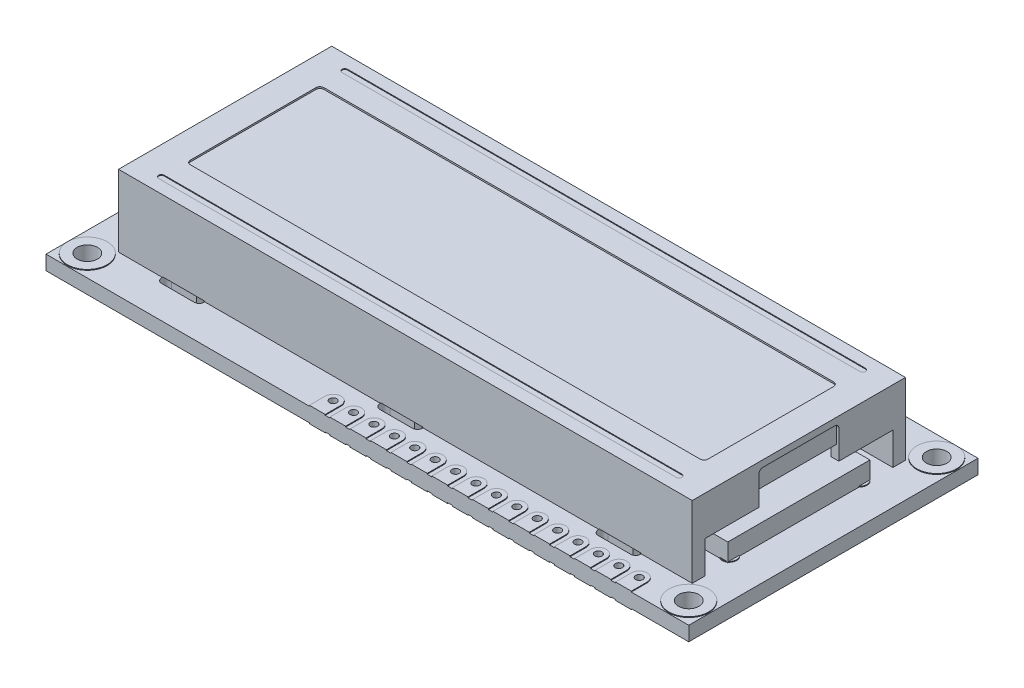
from build123d import *

# Parameters (mm, degrees)
BOSS_EXTRUDE2_START      = 1.79
SKETCH1_W                = 71.407025944
SKETCH1_H                = 26.53942813
BOSS_EXTRUDE2_DEPTH      = 8.93
BOSS_EXTRUDE3_DEPTH      = 1.79
CUT_EXTRUDE1_START       = 10.72
SKETCH4_W                = 64.44
SKETCH4_H                = 16.63
CUT_EXTRUDE1_DEPTH       = 0.2
SKETCH6_R                = 0.352432543
CUT_EXTRUDE4_DEPTH       = 0.1
FILLET1_R                = 0.5
SKETCH7_W                = 23.4
SKETCH7_H                = 4.04
CUT_EXTRUDE5_DEPTH       = 89.379400315
BOSS_EXTRUDE5_START      = -2
SKETCH8_W                = 17.685
SKETCH8_H                = 2.25
BOSS_EXTRUDE5_DEPTH      = 69.41
BOSS_EXTRUDE6_REACH      = 89.981
CUT_EXTRUDE6_DEPTH       = 0.3
FILLET2_R                = 0.5
SKETCH15_W               = 9.96
SKETCH15_H               = 1.67
CUT_EXTRUDE7_DEPTH       = 70.4
CUT_EXTRUDE8_START       = -1
SKETCH18_W               = 6.72
SKETCH18_H               = 1.67
CUT_EXTRUDE8_DEPTH       = 68.4
BOSS_EXTRUDE7_START      = -0.1
SKETCH20_R               = 2.475
BOSS_EXTRUDE7_DEPTH      = 1.99
CUT_EXTRUDE10_DEPTH      = 89.379400315
CUT_EXTRUDE10_DEPTH_BACK = 89.379400315
SKETCH23_R               = 1.27
BOSS_EXTRUDE16_START     = -0.1
SKETCH24_R               = 0.9
BOSS_EXTRUDE16_DEPTH     = 1.99
SKETCH24_R_2             = 0.6
BOSS_EXTRUDE16_2_DEPTH   = 1.99
SKETCH24_W               = 1.2
SKETCH24_H               = 1.204526413
BOSS_EXTRUDE16_3_DEPTH   = 1.99
BOSS_EXTRUDE16_4_DEPTH   = 1.99
BOSS_EXTRUDE16_5_DEPTH   = 1.99
BOSS_EXTRUDE16_6_DEPTH   = 1.99
BOSS_EXTRUDE16_7_DEPTH   = 1.99
BOSS_EXTRUDE16_8_DEPTH   = 1.99
BOSS_EXTRUDE16_9_DEPTH   = 1.99
BOSS_EXTRUDE16_10_DEPTH  = 1.99
CUT_EXTRUDE11_START      = -0.1
SKETCH26_R               = 0.54
SKETCH26_R_2             = 0.45
CUT_EXTRUDE11_DEPTH      = 1.99
BOSS_EXTRUDE17_START     = -0.1
BOSS_EXTRUDE17_DEPTH     = 1.99
CUT_EXTRUDE12_DEPTH      = 89.379400315
CUT_EXTRUDE12_DEPTH_BACK = 89.379400315
SKETCH28_R               = 0.45
SKETCH29_R               = 0.99
SKETCH29_W               = 2
SKETCH29_H               = 1.7
SKETCH29_W_2             = 5.294286071
SKETCH29_H_2             = 1.365740389
SKETCH29_W_3             = 1.6
SKETCH29_H_3             = 1.15
SKETCH29_W_4             = 1.15
SKETCH29_H_4             = 1.6
SKETCH29_W_5             = 1.46
SKETCH29_H_5             = 1.21
SKETCH29_W_6             = 5.294286072
BOSS_EXTRUDE18_DEPTH     = 0.1
CUT_EXTRUDE13_START      = 0.1
SKETCH30_R               = 0.375
CUT_EXTRUDE13_DEPTH      = 1.97
SKETCH31_R               = 0.625142546
CUT_EXTRUDE14_DEPTH      = 1.97
EXTRUDE_THIN1_START      = 1.29
EXTRUDE_THIN1_DEPTH      = 0.375
FILLET3_R                = 0.2
LPATTERN1_COUNT          = 2
LPATTERN1_PITCH          = 2.58
FILLET3_OF_LPATTERN1_R   = 0.2
BOSS_EXTRUDE19_START     = 0.1
BOSS_EXTRUDE19_DEPTH     = 1.89
BOSS_EXTRUDE19_2_DEPTH   = 1.89
BOSS_EXTRUDE19_3_DEPTH   = 1.89
BOSS_EXTRUDE19_4_DEPTH   = 1.89
BOSS_EXTRUDE19_5_DEPTH   = 1.89
BOSS_EXTRUDE19_6_DEPTH   = 1.89
BOSS_EXTRUDE20_START     = 0.1
BOSS_EXTRUDE20_DEPTH     = 1.79
FILLET4_R                = 0.2
SKETCH43_W               = 0.498907935
SKETCH43_H               = 1.15
SKETCH43_W_2             = 0.495939781
SKETCH43_W_3             = 0.49593978
BOSS_EXTRUDE21_DEPTH     = 1
SKETCH44_W               = 1.405152284
SKETCH44_H               = 1.16495193
SKETCH44_W_2             = 1.405152285
BOSS_EXTRUDE22_DEPTH     = 1.2
SKETCH45_W               = 2
SKETCH45_H               = 0.206884679
BOSS_EXTRUDE23_DEPTH     = 1
SKETCH47_W               = 2.034787358
SKETCH47_H               = 2.786230642
BOSS_EXTRUDE24_DEPTH     = 1.1
SKETCH48_R               = 5.25
SKETCH48_R_2             = 6.5
BOSS_EXTRUDE25_DEPTH     = 2
FILLET5_R                = 7.49
FILLET6_R                = 11


with BuildPart() as part:
    # Sketch1 → Boss-Extrude2 (new body)
    with BuildSketch(Plane(origin=(0, 0, 0), x_dir=(1, 0, 0), z_dir=(0, 1, 0)).offset(BOSS_EXTRUDE2_START)):
        with Locations((40, 18)):
            Rectangle(SKETCH1_W, SKETCH1_H)
    extrude(amount=BOSS_EXTRUDE2_DEPTH)

    # Sketch3 → Boss-Extrude3 (add)
    with BuildSketch(Plane(origin=(0, 0, 0), x_dir=(1, 0, 0), z_dir=(0, 1, 0))):
        Polygon((80, 36), (40, 36), (0, 36), (0, 0), (80, 0), align=None)
    extrude(amount=BOSS_EXTRUDE3_DEPTH)

    # Sketch4 → Cut-Extrude1 (cut)
    with BuildSketch(Plane(origin=(0, 0, 0), x_dir=(1, 0, 0), z_dir=(0, 1, 0)).offset(CUT_EXTRUDE1_START)):
        with Locations((40, 18)):
            Rectangle(SKETCH4_W, SKETCH4_H)
    extrude(amount=-CUT_EXTRUDE1_DEPTH, mode=Mode.SUBTRACT)

    # Sketch6 → Cut-Extrude4 (cut)
    with BuildSketch(Plane(origin=(0, 10.72, 0), x_dir=(1, 0, 0), z_dir=(0, 1, 0))):
        with BuildLine():
            Line((72.22, 29.769714065), (7.78, 29.769714065))
            ThreePointArc((7.78, 29.769714065), (8.029207441, 29.666488962), (8.132432543, 29.417281521))
            ThreePointArc((8.132432543, 29.417281521), (8.029207441, 29.16807408), (7.78, 29.064848978))
            Line((7.78, 29.064848978), (72.22, 29.064848978))
            ThreePointArc((72.22, 29.064848978), (71.867567457, 29.417281521), (72.22, 29.769714065))
        make_face()
        with Locations((72.22, 29.417281521)):
            Circle(SKETCH6_R)
        with Locations((7.78, 29.417281521)):
            Circle(SKETCH6_R)
    cut_extrude4 = extrude(amount=-CUT_EXTRUDE4_DEPTH, mode=Mode.SUBTRACT)

    # Mirror1: Cut-Extrude4 across plane
    add(cut_extrude4.mirror(Plane.XY.offset(-18)), mode=Mode.SUBTRACT)

    # Fillet1
    fillet1_edges = [part.edges().sort_by_distance(p)[0] for p in [
        (7.78, 10.62, -26.315),
        (72.22, 10.62, -26.315),
        (72.22, 10.62, -9.685),
        (7.78, 10.62, -9.685),
    ]]
    fillet(fillet1_edges, radius=FILLET1_R)

    # Sketch7 → Cut-Extrude5 (cut, through all)
    with BuildSketch(Plane(origin=(0, 0, 0), x_dir=(0, 0, -1), z_dir=(1, 0, 0))):
        with Locations((18, 3.81)):
            Rectangle(SKETCH7_W, SKETCH7_H)
    extrude(amount=CUT_EXTRUDE5_DEPTH, mode=Mode.SUBTRACT)

    # Sketch8 → Boss-Extrude5 (add)
    with BuildSketch(Plane.ZY.offset(-4.296487028).offset(BOSS_EXTRUDE5_START)):
        with Locations((-17.9975, 2.915)):
            Rectangle(SKETCH8_W, SKETCH8_H)
    extrude(amount=-BOSS_EXTRUDE5_DEPTH)

    # Sketch13 → Boss-Extrude6 (add, up to next)
    with BuildSketch(Plane(origin=(0, 4.04, 0), x_dir=(1, 0, 0), z_dir=(0, 1, 0)), mode=Mode.PRIVATE) as boss_extrude6_sk1:
        Polygon((6.296487028, 26.84), (6.296487028, 9.155), (1.5, 15.0675), (1.5, 20.9275), align=None)
    boss_extrude6_tool1 = extrude(boss_extrude6_sk1.sketch, amount=-BOSS_EXTRUDE6_REACH, mode=Mode.PRIVATE) - part.part
    add(boss_extrude6_tool1.solids().sort_by_distance((4.299733, 4.04, -17.9975))[0])

    # Sketch14 → Cut-Extrude6 (cut)
    with BuildSketch(Plane(origin=(75.703512972, 0, 0), x_dir=(0, 0, -1), z_dir=(1, 0, 0))):
        Polygon((22.98, 9.9), (22.98, 5.83), (13.02, 5.83), (13.02, 9.9), (18, 9.9), align=None)
    extrude(amount=-CUT_EXTRUDE6_DEPTH, mode=Mode.SUBTRACT)

    # Fillet2
    fillet2_edges = [part.edges().sort_by_distance(p)[0] for p in [
        (75.553512972, 9.9, -22.98),
        (75.553512972, 9.9, -13.02),
    ]]
    fillet(fillet2_edges, radius=FILLET2_R)

    # Sketch15 → Cut-Extrude7 (cut)
    with BuildSketch(Plane(origin=(75.403512972, 0, 0), x_dir=(0, 0, -1), z_dir=(1, 0, 0))):
        with Locations((18, 6.665)):
            Rectangle(SKETCH15_W, SKETCH15_H)
    extrude(amount=-CUT_EXTRUDE7_DEPTH, mode=Mode.SUBTRACT)

    # Sketch18 → Cut-Extrude8 (cut)
    with BuildSketch(Plane(origin=(75.703512972, 0, 0), x_dir=(0, 0, -1), z_dir=(1, 0, 0)).offset(CUT_EXTRUDE8_START)):
        with Locations((9.66, 6.665)):
            Rectangle(SKETCH18_W, SKETCH18_H)
        with Locations((26.34, 6.665)):
            Rectangle(SKETCH18_W, SKETCH18_H)
    extrude(amount=-CUT_EXTRUDE8_DEPTH, mode=Mode.SUBTRACT)

    # Sketch20 → Boss-Extrude7 (add)
    with BuildSketch(Plane(origin=(0, 0, 0), x_dir=(1, 0, 0), z_dir=(0, 1, 0)).offset(BOSS_EXTRUDE7_START)):
        with Locations(Location((2.57, 33.43, 0), (0, 0, 270))):
            Circle(SKETCH20_R)
        with Locations(Location((77.43, 33.43, 0), (0, 0, 270))):
            Circle(SKETCH20_R)
        with Locations(Location((2.57, 2.57, 0), (0, 0, 270))):
            Circle(SKETCH20_R)
        with Locations(Location((77.43, 2.57, 0), (0, 0, 270))):
            Circle(SKETCH20_R)
    extrude(amount=BOSS_EXTRUDE7_DEPTH)

    # Sketch23 → Cut-Extrude10 (cut, two sides: drawn at the far end of the back side and taken through both)
    with BuildSketch(Plane(origin=(0, 0, 0), x_dir=(1, 0, 0), z_dir=(0, 1, 0)).offset(-CUT_EXTRUDE10_DEPTH_BACK)):
        with Locations(Location((2.57, 33.43, 0), (0, 0, 270))):
            Circle(SKETCH23_R)
        with Locations(Location((77.43, 33.43, 0), (0, 0, 270))):
            Circle(SKETCH23_R)
        with Locations(Location((2.57, 2.57, 0), (0, 0, 270))):
            Circle(SKETCH23_R)
        with Locations(Location((77.43, 2.57, 0), (0, 0, 270))):
            Circle(SKETCH23_R)
    extrude(amount=CUT_EXTRUDE10_DEPTH + CUT_EXTRUDE10_DEPTH_BACK, mode=Mode.SUBTRACT)


with BuildPart() as body_2:
    # Sketch24 → Boss-Extrude16 (new body)
    with BuildSketch(Plane(origin=(0, 0, 0), x_dir=(1, 0, 0), z_dir=(0, 1, 0)).offset(BOSS_EXTRUDE16_START)):
        with Locations(Location((0.9, 21.88, 0), (0, 0, 270))):
            Circle(SKETCH24_R)
    extrude(amount=BOSS_EXTRUDE16_DEPTH)


with BuildPart() as body_3:
    # Sketch24 → Boss-Extrude16 2 (new body)
    with BuildSketch(Plane(origin=(0, 0, 0), x_dir=(1, 0, 0), z_dir=(0, 1, 0)).offset(BOSS_EXTRUDE16_START)):
        with Locations(Location((0.9, 19.283267048, 0), (0, 0, 270))):
            Circle(SKETCH24_R_2)
    extrude(amount=BOSS_EXTRUDE16_2_DEPTH)


with BuildPart() as body_4:
    # Sketch24 → Boss-Extrude16 3 (new body)
    with BuildSketch(Plane(origin=(0, 0, 0), x_dir=(1, 0, 0), z_dir=(0, 1, 0)).offset(BOSS_EXTRUDE16_START)):
        with Locations((0.9, 16.704445775)):
            Rectangle(SKETCH24_W, SKETCH24_H)
    extrude(amount=BOSS_EXTRUDE16_3_DEPTH)


with BuildPart() as body_5:
    # Sketch24 → Boss-Extrude16 4 (new body)
    with BuildSketch(Plane(origin=(0, 0, 0), x_dir=(1, 0, 0), z_dir=(0, 1, 0)).offset(BOSS_EXTRUDE16_START)):
        with Locations(Location((0.9, 14.2, 0), (0, 0, 270))):
            Circle(SKETCH24_R)
    extrude(amount=BOSS_EXTRUDE16_4_DEPTH)


with BuildPart() as body_6:
    # Sketch24 → Boss-Extrude16 5 (new body)
    with BuildSketch(Plane(origin=(0, 0, 0), x_dir=(1, 0, 0), z_dir=(0, 1, 0)).offset(BOSS_EXTRUDE16_START)):
        with Locations(Location((4.85, 9.95, 0), (0, 0, 270))):
            Circle(SKETCH24_R)
    extrude(amount=BOSS_EXTRUDE16_5_DEPTH)


with BuildPart() as body_7:
    # Sketch24 → Boss-Extrude16 6 (new body)
    with BuildSketch(Plane(origin=(0, 0, 0), x_dir=(1, 0, 0), z_dir=(0, 1, 0)).offset(BOSS_EXTRUDE16_START)):
        with Locations(Location((0.9, 10.6, 0), (0, 0, 270))):
            Circle(SKETCH24_R)
    extrude(amount=BOSS_EXTRUDE16_6_DEPTH)


with BuildPart() as body_8:
    # Sketch24 → Boss-Extrude16 7 (new body)
    with BuildSketch(Plane(origin=(0, 0, 0), x_dir=(1, 0, 0), z_dir=(0, 1, 0)).offset(BOSS_EXTRUDE16_START)):
        with Locations(Location((75.11, 9.95, 0), (0, 0, 270))):
            Circle(SKETCH24_R)
    extrude(amount=BOSS_EXTRUDE16_7_DEPTH)


with BuildPart() as body_9:
    # Sketch24 → Boss-Extrude16 8 (new body)
    with BuildSketch(Plane(origin=(0, 0, 0), x_dir=(1, 0, 0), z_dir=(0, 1, 0)).offset(BOSS_EXTRUDE16_START)):
        with Locations(Location((75.11, 26.17, 0), (0, 0, 270))):
            Circle(SKETCH24_R)
    extrude(amount=BOSS_EXTRUDE16_8_DEPTH)


with BuildPart() as body_10:
    # Sketch24 → Boss-Extrude16 9 (new body)
    with BuildSketch(Plane(origin=(0, 0, 0), x_dir=(1, 0, 0), z_dir=(0, 1, 0)).offset(BOSS_EXTRUDE16_START)):
        with Locations(Location((0.9, 25.72, 0), (0, 0, 270))):
            Circle(SKETCH24_R)
    extrude(amount=BOSS_EXTRUDE16_9_DEPTH)


with BuildPart() as body_11:
    # Sketch24 → Boss-Extrude16 10 (new body)
    with BuildSketch(Plane(origin=(0, 0, 0), x_dir=(1, 0, 0), z_dir=(0, 1, 0)).offset(BOSS_EXTRUDE16_START)):
        with Locations(Location((4.85, 26.17, 0), (0, 0, 270))):
            Circle(SKETCH24_R)
    extrude(amount=BOSS_EXTRUDE16_10_DEPTH)


with BuildPart() as cut_extrude11_tool:
    # Sketch26 → Cut-Extrude11 (new body)
    with BuildSketch(Plane(origin=(0, 0, 0), x_dir=(1, 0, 0), z_dir=(0, 1, 0)).offset(CUT_EXTRUDE11_START)):
        with Locations(Location((0.9, 25.72, 0), (0, 0, 270))):
            Circle(SKETCH26_R)
        with Locations(Location((4.85, 26.17, 0), (0, 0, 270))):
            Circle(SKETCH26_R)
        with Locations(Location((0.9, 21.88, 0), (0, 0, 270))):
            Circle(SKETCH26_R)
        with Locations(Location((0.9, 19.283267048, 0), (0, 0, 270))):
            Circle(SKETCH26_R_2)
        with Locations(Location((0.9, 14.2, 0), (0, 0, 270))):
            Circle(SKETCH26_R)
        with Locations(Location((0.9, 10.6, 0), (0, 0, 270))):
            Circle(SKETCH26_R)
        with Locations(Location((4.85, 9.95, 0), (0, 0, 270))):
            Circle(SKETCH26_R)
        with Locations(Location((75.11, 9.95, 0), (0, 0, 270))):
            Circle(SKETCH26_R)
        with Locations(Location((0.9, 16.704445775, 0), (0, 0, 270))):
            Circle(SKETCH26_R_2)
        with Locations(Location((75.11, 26.17, 0), (0, 0, 270))):
            Circle(SKETCH26_R)
    extrude(amount=CUT_EXTRUDE11_DEPTH)


with BuildPart() as part_1:
    add(part.part)

    # Cut-Extrude11: cut by cut_extrude11_tool
    add(cut_extrude11_tool.part, mode=Mode.SUBTRACT)

    # Sketch27 → Boss-Extrude17 (add)
    with BuildSketch(Plane(origin=(0, 0, 0), x_dir=(1, 0, 0), z_dir=(0, 1, 0)).offset(BOSS_EXTRUDE17_START)):
        with BuildLine():
            Line((70.883737645, 0), (72.85, 0))
            Line((72.85, 0), (72.85, 1.97))
            ThreePointArc((72.85, 1.97), (71.866868823, 2.953131177), (70.883737645, 1.97))
            Line((70.883737645, 1.97), (70.883737645, 0))
        make_face()
        with BuildLine():
            Line((68.343737645, 1.97), (68.343737645, 0))
            Line((68.343737645, 0), (70.31, 0))
            Line((70.31, 0), (70.31, 1.97))
            ThreePointArc((70.31, 1.97), (69.326868823, 2.953131177), (68.343737645, 1.97))
        make_face()
        with BuildLine():
            Line((65.803737645, 1.97), (65.803737645, 0))
            Line((65.803737645, 0), (67.77, 0))
            Line((67.77, 0), (67.77, 1.97))
            ThreePointArc((67.77, 1.97), (66.786868823, 2.953131177), (65.803737645, 1.97))
        make_face()
        with BuildLine():
            Line((63.263737645, 1.97), (63.263737645, 0))
            Line((63.263737645, 0), (65.23, 0))
            Line((65.23, 0), (65.23, 1.97))
            ThreePointArc((65.23, 1.97), (64.246868823, 2.953131177), (63.263737645, 1.97))
        make_face()
        with BuildLine():
            Line((60.723737645, 1.97), (60.723737645, 0))
            Line((60.723737645, 0), (62.69, 0))
            Line((62.69, 0), (62.69, 1.97))
            ThreePointArc((62.69, 1.97), (61.706868823, 2.953131177), (60.723737645, 1.97))
        make_face()
        with BuildLine():
            Line((58.183737645, 1.97), (58.183737645, 0))
            Line((58.183737645, 0), (60.15, 0))
            Line((60.15, 0), (60.15, 1.97))
            ThreePointArc((60.15, 1.97), (59.166868823, 2.953131177), (58.183737645, 1.97))
        make_face()
        with BuildLine():
            Line((55.643737645, 1.97), (55.643737645, 0))
            Line((55.643737645, 0), (57.61, 0))
            Line((57.61, 0), (57.61, 1.97))
            ThreePointArc((57.61, 1.97), (56.626868823, 2.953131177), (55.643737645, 1.97))
        make_face()
        with BuildLine():
            Line((53.103737645, 1.97), (53.103737645, 0))
            Line((53.103737645, 0), (55.07, 0))
            Line((55.07, 0), (55.07, 1.97))
            ThreePointArc((55.07, 1.97), (54.086868823, 2.953131177), (53.103737645, 1.97))
        make_face()
        with BuildLine():
            Line((50.563737645, 1.97), (50.563737645, 0))
            Line((50.563737645, 0), (52.53, 0))
            Line((52.53, 0), (52.53, 1.97))
            ThreePointArc((52.53, 1.97), (51.546868823, 2.953131177), (50.563737645, 1.97))
        make_face()
        with BuildLine():
            Line((48.023737645, 1.97), (48.023737645, 0))
            Line((48.023737645, 0), (49.99, 0))
            Line((49.99, 0), (49.99, 1.97))
            ThreePointArc((49.99, 1.97), (49.006868823, 2.953131177), (48.023737645, 1.97))
        make_face()
        with BuildLine():
            Line((45.483737645, 1.97), (45.483737645, 0))
            Line((45.483737645, 0), (47.45, 0))
            Line((47.45, 0), (47.45, 1.97))
            ThreePointArc((47.45, 1.97), (46.466868823, 2.953131177), (45.483737645, 1.97))
        make_face()
        with BuildLine():
            Line((42.943737645, 1.97), (42.943737645, 0))
            Line((42.943737645, 0), (44.91, 0))
            Line((44.91, 0), (44.91, 1.97))
            ThreePointArc((44.91, 1.97), (43.926868823, 2.953131177), (42.943737645, 1.97))
        make_face()
        with BuildLine():
            Line((40.403737645, 1.97), (40.403737645, 0))
            Line((40.403737645, 0), (42.37, 0))
            Line((42.37, 0), (42.37, 1.97))
            ThreePointArc((42.37, 1.97), (41.386868823, 2.953131177), (40.403737645, 1.97))
        make_face()
        with BuildLine():
            Line((37.863737645, 1.97), (37.863737645, 0))
            Line((37.863737645, 0), (39.83, 0))
            Line((39.83, 0), (39.83, 1.97))
            ThreePointArc((39.83, 1.97), (38.846868823, 2.953131177), (37.863737645, 1.97))
        make_face()
        with BuildLine():
            Line((35.323737645, 1.97), (35.323737645, 0))
            Line((35.323737645, 0), (37.29, 0))
            Line((37.29, 0), (37.29, 1.97))
            ThreePointArc((37.29, 1.97), (36.306868823, 2.953131177), (35.323737645, 1.97))
        make_face()
        with BuildLine():
            Line((32.783737645, 1.97), (32.783737645, 0))
            Line((32.783737645, 0), (34.75, 0))
            Line((34.75, 0), (34.75, 1.97))
            ThreePointArc((34.75, 1.97), (33.766868823, 2.953131177), (32.783737645, 1.97))
        make_face()
    extrude(amount=BOSS_EXTRUDE17_DEPTH)

    # Sketch28 → Cut-Extrude12 (cut, two sides: drawn at the far end of the back side and taken through both)
    with BuildSketch(Plane(origin=(0, 0, 0), x_dir=(1, 0, 0), z_dir=(0, 1, 0)).offset(-CUT_EXTRUDE12_DEPTH_BACK)):
        with Locations(Location((36.306868823, 1.97, 0), (0, 0, 270))):
            Circle(SKETCH28_R)
        with Locations(Location((38.846868823, 1.97, 0), (0, 0, 270))):
            Circle(SKETCH28_R)
        with Locations(Location((41.386868823, 1.97, 0), (0, 0, 270))):
            Circle(SKETCH28_R)
        with Locations(Location((43.926868823, 1.97, 0), (0, 0, 270))):
            Circle(SKETCH28_R)
        with Locations(Location((46.466868823, 1.97, 0), (0, 0, 270))):
            Circle(SKETCH28_R)
        with Locations(Location((51.546868823, 1.97, 0), (0, 0, 270))):
            Circle(SKETCH28_R)
        with Locations(Location((54.086868823, 1.97, 0), (0, 0, 270))):
            Circle(SKETCH28_R)
        with Locations(Location((56.626868823, 1.97, 0), (0, 0, 270))):
            Circle(SKETCH28_R)
        with Locations(Location((59.166868823, 1.97, 0), (0, 0, 270))):
            Circle(SKETCH28_R)
        with Locations(Location((61.706868823, 1.97, 0), (0, 0, 270))):
            Circle(SKETCH28_R)
        with Locations(Location((64.246868823, 1.97, 0), (0, 0, 270))):
            Circle(SKETCH28_R)
        with Locations(Location((66.786868823, 1.97, 0), (0, 0, 270))):
            Circle(SKETCH28_R)
        with Locations(Location((69.326868823, 1.97, 0), (0, 0, 270))):
            Circle(SKETCH28_R)
        with Locations(Location((71.866868823, 1.97, 0), (0, 0, 270))):
            Circle(SKETCH28_R)
        with Locations(Location((33.766868823, 1.97, 0), (0, 0, 270))):
            Circle(SKETCH28_R)
        with Locations(Location((49.006868823, 1.97, 0), (0, 0, 270))):
            Circle(SKETCH28_R)
    extrude(amount=CUT_EXTRUDE12_DEPTH + CUT_EXTRUDE12_DEPTH_BACK, mode=Mode.SUBTRACT)

    # Sketch29 → Boss-Extrude18 (add)
    with BuildSketch(Plane(origin=(0, 0, 0), x_dir=(-1, 0, 0), z_dir=(0, -1, 0))):
        with Locations(Location((-4.85, 14.85, 0), (0, 0, 270))):
            Circle(SKETCH29_R)
        with Locations((-8.27, 14.92)):
            Rectangle(SKETCH29_W, SKETCH29_H)
        with Locations((-8.27, 18.12)):
            Rectangle(SKETCH29_W, SKETCH29_H)
        with Locations((-13.2, 17.05)):
            Rectangle(SKETCH29_W, SKETCH29_H)
        with Locations((-13.2, 13.85)):
            Rectangle(SKETCH29_W, SKETCH29_H)
        with Locations((-8.27, 22.1)):
            Rectangle(SKETCH29_W, SKETCH29_H)
        with Locations((-8.27, 25.3)):
            Rectangle(SKETCH29_W, SKETCH29_H)
        with Locations(Location((-4.85, 21.86, 0), (0, 0, 270))):
            Circle(SKETCH29_R)
        with Locations((-12.384284821, 29.762870195)):
            Rectangle(SKETCH29_W_2, SKETCH29_H_2)
        with Locations((-26.35, 18.295)):
            Rectangle(SKETCH29_W_3, SKETCH29_H_3)
        with Locations((-26.35, 20.245)):
            Rectangle(SKETCH29_W_3, SKETCH29_H_3)
        with Locations((-26.35, 22.195)):
            Rectangle(SKETCH29_W_3, SKETCH29_H_3)
        with Locations((-28.75, 22.195)):
            Rectangle(SKETCH29_W_3, SKETCH29_H_3)
        with Locations((-28.75, 20.245)):
            Rectangle(SKETCH29_W_3, SKETCH29_H_3)
        with Locations((-28.75, 18.295)):
            Rectangle(SKETCH29_W_3, SKETCH29_H_3)
        with Locations((-66.712856964, 29.762870195)):
            Rectangle(SKETCH29_W_2, SKETCH29_H_2)
        with Locations((-69.385, 26.5375)):
            Rectangle(SKETCH29_W_4, SKETCH29_H_4)
        with Locations((-73.9, 23.625)):
            Rectangle(SKETCH29_W_3, SKETCH29_H_3)
        with Locations((-76.3, 23.625)):
            Rectangle(SKETCH29_W_3, SKETCH29_H_3)
        with Locations((-76.3, 21.675)):
            Rectangle(SKETCH29_W_3, SKETCH29_H_3)
        with Locations((-73.9, 21.675)):
            Rectangle(SKETCH29_W_3, SKETCH29_H_3)
        with Locations((-73.9, 19.725)):
            Rectangle(SKETCH29_W_3, SKETCH29_H_3)
        with Locations((-76.3, 19.725)):
            Rectangle(SKETCH29_W_3, SKETCH29_H_3)
        with Locations((-76.92, 15.515)):
            Rectangle(SKETCH29_W_5, SKETCH29_H_5)
        with Locations((-66.712856964, 6.172870194)):
            Rectangle(SKETCH29_W_2, SKETCH29_H_2)
        with Locations((-12.384284821, 6.172870194)):
            Rectangle(SKETCH29_W_2, SKETCH29_H_2)
        with Locations((-39.548570893, 29.762870195)):
            Rectangle(SKETCH29_W_6, SKETCH29_H_2)
        with Locations((-69.385, 24.1375)):
            Rectangle(SKETCH29_W_4, SKETCH29_H_4)
        with Locations((-74.86, 15.515)):
            Rectangle(SKETCH29_W_5, SKETCH29_H_5)
        with Locations((-39.548570893, 6.172870194)):
            Rectangle(SKETCH29_W_6, SKETCH29_H_2)
    extrude(amount=BOSS_EXTRUDE18_DEPTH)

    # Sketch30 → Cut-Extrude13 (cut)
    with BuildSketch(Plane(origin=(0, 0, 0), x_dir=(-1, 0, 0), z_dir=(0, -1, 0)).offset(CUT_EXTRUDE13_START)):
        with Locations(Location((-4.85, 21.86, 0), (0, 0, 90))):
            Circle(SKETCH30_R)
        with Locations(Location((-4.85, 14.85, 0), (0, 0, 90))):
            Circle(SKETCH30_R)
    extrude(amount=-CUT_EXTRUDE13_DEPTH, mode=Mode.SUBTRACT)

    # Sketch31 → Cut-Extrude14 (cut)
    with BuildSketch(Plane(origin=(0, -0.1, 0), x_dir=(-1, 0, 0), z_dir=(0, -1, 0))):
        with BuildLine():
            ThreePointArc((-10.362284332, 4.034857454), (-10.987426879, 4.66), (-10.362284332, 5.285142546))
            Line((-10.362284332, 5.285142546), (-14.406285311, 5.285142546))
            ThreePointArc((-14.406285311, 5.285142546), (-13.964242777, 5.102042534), (-13.781142764, 4.66))
            ThreePointArc((-13.781142764, 4.66), (-13.964242777, 4.217957466), (-14.406285311, 4.034857454))
            Line((-14.406285311, 4.034857454), (-10.362284332, 4.034857454))
        make_face()
        with Locations((-10.362284332, 4.66)):
            Circle(SKETCH31_R)
        with Locations((-14.406285311, 4.66)):
            Circle(SKETCH31_R)
        with BuildLine():
            ThreePointArc((-10.362284332, 30.650597843), (-10.987426879, 31.275740389), (-10.362284332, 31.900882936))
            Line((-10.362284332, 31.900882936), (-14.406285311, 31.900882936))
            ThreePointArc((-14.406285311, 31.900882936), (-13.964242777, 31.717782923), (-13.781142764, 31.275740389))
            ThreePointArc((-13.781142764, 31.275740389), (-13.964242777, 30.833697856), (-14.406285311, 30.650597843))
            Line((-14.406285311, 30.650597843), (-10.362284332, 30.650597843))
        make_face()
        with Locations((-14.406285311, 31.275740389)):
            Circle(SKETCH31_R)
        with Locations((-10.362284332, 31.275740389)):
            Circle(SKETCH31_R)
        with Locations((-37.526570404, 31.275740389)):
            Circle(SKETCH31_R)
        with BuildLine():
            ThreePointArc((-37.526570404, 30.650597843), (-38.15171295, 31.275740389), (-37.526570404, 31.900882936))
            Line((-37.526570404, 31.900882936), (-41.570571382, 31.900882936))
            ThreePointArc((-41.570571382, 31.900882936), (-41.128528848, 31.717782923), (-40.945428836, 31.275740389))
            ThreePointArc((-40.945428836, 31.275740389), (-41.128528848, 30.833697856), (-41.570571382, 30.650597843))
            Line((-41.570571382, 30.650597843), (-37.526570404, 30.650597843))
        make_face()
        with Locations((-41.570571382, 31.275740389)):
            Circle(SKETCH31_R)
        with Locations((-64.690856475, 31.275740389)):
            Circle(SKETCH31_R)
        with BuildLine():
            ThreePointArc((-64.690856475, 30.650597843), (-65.315999021, 31.275740389), (-64.690856475, 31.900882936))
            Line((-64.690856475, 31.900882936), (-68.734857454, 31.900882936))
            ThreePointArc((-68.734857454, 31.900882936), (-68.29281492, 31.717782923), (-68.109714907, 31.275740389))
            ThreePointArc((-68.109714907, 31.275740389), (-68.29281492, 30.833697856), (-68.734857454, 30.650597843))
            Line((-68.734857454, 30.650597843), (-64.690856475, 30.650597843))
        make_face()
        with Locations((-68.734857454, 31.275740389)):
            Circle(SKETCH31_R)
        with BuildLine():
            ThreePointArc((-37.526570404, 4.034857454), (-38.15171295, 4.66), (-37.526570404, 5.285142546))
            Line((-37.526570404, 5.285142546), (-41.570571382, 5.285142546))
            ThreePointArc((-41.570571382, 5.285142546), (-41.128528848, 5.102042534), (-40.945428836, 4.66))
            ThreePointArc((-40.945428836, 4.66), (-41.128528848, 4.217957466), (-41.570571382, 4.034857454))
            Line((-41.570571382, 4.034857454), (-37.526570404, 4.034857454))
        make_face()
        with Locations((-37.526570404, 4.66)):
            Circle(SKETCH31_R)
        with Locations((-41.570571382, 4.66)):
            Circle(SKETCH31_R)
        with BuildLine():
            ThreePointArc((-64.690856475, 4.034857454), (-65.315999021, 4.66), (-64.690856475, 5.285142546))
            Line((-64.690856475, 5.285142546), (-68.734857454, 5.285142546))
            ThreePointArc((-68.734857454, 5.285142546), (-68.29281492, 5.102042534), (-68.109714907, 4.66))
            ThreePointArc((-68.109714907, 4.66), (-68.29281492, 4.217957466), (-68.734857454, 4.034857454))
            Line((-68.734857454, 4.034857454), (-64.690856475, 4.034857454))
        make_face()
        with Locations((-68.734857454, 4.66)):
            Circle(SKETCH31_R)
        with Locations((-64.690856475, 4.66)):
            Circle(SKETCH31_R)
    extrude(amount=-CUT_EXTRUDE14_DEPTH, mode=Mode.SUBTRACT)


with BuildPart() as body_2_1:
    add(body_2.part)

    # Cut-Extrude11: cut by cut_extrude11_tool
    add(cut_extrude11_tool.part, mode=Mode.SUBTRACT)


with BuildPart() as body_3_1:
    add(body_3.part)

    # Cut-Extrude11: cut by cut_extrude11_tool
    add(cut_extrude11_tool.part, mode=Mode.SUBTRACT)


with BuildPart() as body_4_1:
    add(body_4.part)

    # Cut-Extrude11: cut by cut_extrude11_tool
    add(cut_extrude11_tool.part, mode=Mode.SUBTRACT)


    add(part_1.part)  # Extrude-Thin1 merges part
    # Sketch40 → Extrude-Thin1 (add, symmetric)
    with BuildSketch(Plane.XY.offset(-18).offset(EXTRUDE_THIN1_START)):
        Polygon((1.5, 2.915), (0.9, 2.915), (0.9, -0.1), (0.7, -0.1), (0.7, 3.115), (1.5, 3.115), align=None)
    extrude_thin1 = extrude(amount=EXTRUDE_THIN1_DEPTH, both=True)

    # Fillet3
    fillet3_edges = [body_4_1.edges().sort_by_distance(p)[0] for p in [
        (0.7, 3.115, -16.71),
    ]]
    fillet(fillet3_edges, radius=FILLET3_R)

    # LPattern1: Extrude-Thin1 ×2
    with Locations(*[(0, 0, -i * LPATTERN1_PITCH) for i in range(1, LPATTERN1_COUNT)]):
        add(extrude_thin1)

    # Fillet3 of LPattern1
    fillet3_of_lpattern1_edges = [body_4_1.edges().sort_by_distance(p)[0] for p in [
        (0.7, 3.115, -19.29),
    ]]
    fillet(fillet3_of_lpattern1_edges, radius=FILLET3_OF_LPATTERN1_R)



with BuildPart() as body_5_1:
    add(body_5.part)

    # Cut-Extrude11: cut by cut_extrude11_tool
    add(cut_extrude11_tool.part, mode=Mode.SUBTRACT)


with BuildPart() as body_6_1:
    add(body_6.part)

    # Cut-Extrude11: cut by cut_extrude11_tool
    add(cut_extrude11_tool.part, mode=Mode.SUBTRACT)


with BuildPart() as body_7_1:
    add(body_7.part)

    # Cut-Extrude11: cut by cut_extrude11_tool
    add(cut_extrude11_tool.part, mode=Mode.SUBTRACT)


with BuildPart() as body_8_1:
    add(body_8.part)

    # Cut-Extrude11: cut by cut_extrude11_tool
    add(cut_extrude11_tool.part, mode=Mode.SUBTRACT)


with BuildPart() as body_9_1:
    add(body_9.part)

    # Cut-Extrude11: cut by cut_extrude11_tool
    add(cut_extrude11_tool.part, mode=Mode.SUBTRACT)


with BuildPart() as body_10_1:
    add(body_10.part)

    # Cut-Extrude11: cut by cut_extrude11_tool
    add(cut_extrude11_tool.part, mode=Mode.SUBTRACT)


with BuildPart() as body_11_1:
    add(body_11.part)

    # Cut-Extrude11: cut by cut_extrude11_tool
    add(cut_extrude11_tool.part, mode=Mode.SUBTRACT)


with BuildPart() as body_11_2:
    # Sketch41 → Boss-Extrude19 (new body)
    with BuildSketch(Plane(origin=(0, 0, 0), x_dir=(-1, 0, 0), z_dir=(0, -1, 0)).offset(BOSS_EXTRUDE19_START)):
        Polygon((-13.939594835, 4.761268111), (-13.47290436, 5.227958587), (-14.406285311, 5.227958587), align=None)
    extrude(amount=-BOSS_EXTRUDE19_DEPTH)


with BuildPart() as body_12:
    # Sketch41 → Boss-Extrude19 2 (new body)
    with BuildSketch(Plane(origin=(0, 0, 0), x_dir=(-1, 0, 0), z_dir=(0, -1, 0)).offset(BOSS_EXTRUDE19_START)):
        Polygon((-67.801476502, 30.772041413), (-68.734857454, 30.772041413), (-68.268166978, 31.238731889), align=None)
    extrude(amount=-BOSS_EXTRUDE19_2_DEPTH)


with BuildPart() as body_13:
    # Sketch41 → Boss-Extrude19 3 (new body)
    with BuildSketch(Plane(origin=(0, 0, 0), x_dir=(-1, 0, 0), z_dir=(0, -1, 0)).offset(BOSS_EXTRUDE19_START)):
        Polygon((-13.47290436, 30.772041413), (-14.406285311, 30.772041413), (-13.939594835, 31.238731889), align=None)
    extrude(amount=-BOSS_EXTRUDE19_3_DEPTH)


with BuildPart() as body_14:
    # Sketch41 → Boss-Extrude19 4 (new body)
    with BuildSketch(Plane(origin=(0, 0, 0), x_dir=(-1, 0, 0), z_dir=(0, -1, 0)).offset(BOSS_EXTRUDE19_START)):
        Polygon((-41.570571382, 5.227958587), (-41.103880907, 4.761268111), (-40.637190431, 5.227958587), align=None)
    extrude(amount=-BOSS_EXTRUDE19_4_DEPTH)


with BuildPart() as body_15:
    # Sketch41 → Boss-Extrude19 5 (new body)
    with BuildSketch(Plane(origin=(0, 0, 0), x_dir=(-1, 0, 0), z_dir=(0, -1, 0)).offset(BOSS_EXTRUDE19_START)):
        Polygon((-68.734857454, 5.227958587), (-68.268166978, 4.761268111), (-67.801476502, 5.227958587), align=None)
    extrude(amount=-BOSS_EXTRUDE19_5_DEPTH)


with BuildPart() as body_16:
    # Sketch41 → Boss-Extrude19 6 (new body)
    with BuildSketch(Plane(origin=(0, 0, 0), x_dir=(-1, 0, 0), z_dir=(0, -1, 0)).offset(BOSS_EXTRUDE19_START)):
        Polygon((-40.637190431, 30.772041413), (-41.570571382, 30.772041413), (-41.103880907, 31.238731889), align=None)
    extrude(amount=-BOSS_EXTRUDE19_6_DEPTH)


with BuildPart() as body_4_2:
    add(body_4_1.part)

    add(body_11_2.part)  # Boss-Extrude20 merges body 11 2

    add(body_12.part)  # Boss-Extrude20 merges body 12

    add(body_13.part)  # Boss-Extrude20 merges body 13

    add(body_14.part)  # Boss-Extrude20 merges body 14

    add(body_15.part)  # Boss-Extrude20 merges body 15

    add(body_16.part)  # Boss-Extrude20 merges body 16
    # Sketch42 → Boss-Extrude20 (add)
    with BuildSketch(Plane(origin=(0, 0, 0), x_dir=(-1, 0, 0), z_dir=(0, -1, 0)).offset(BOSS_EXTRUDE20_START)):
        Polygon((-12.384251165, 6.316611782), (-13.939594835, 4.761268111), (-14.406285311, 5.227958587), (-12.850941641, 6.783302257), align=None)
        Polygon((-39.546558464, 6.316611782), (-41.101902134, 4.761268111), (-41.568592609, 5.227958587), (-40.013248939, 6.783302257), align=None)
        Polygon((-66.712823308, 6.316611782), (-68.268166978, 4.761268111), (-68.734857454, 5.227958587), (-67.179513783, 6.783302257), align=None)
        Polygon((-13.939594835, 31.238731889), (-12.383959917, 29.68309697), (-12.850941641, 29.216697743), (-14.406285311, 30.772041413), align=None)
        Polygon((-41.101902134, 31.238731889), (-39.546267215, 29.68309697), (-40.013248939, 29.216697743), (-41.568592609, 30.772041413), align=None)
        Polygon((-68.268166978, 31.238731889), (-66.712532059, 29.68309697), (-67.179513783, 29.216697743), (-68.734857454, 30.772041413), align=None)
    extrude(amount=BOSS_EXTRUDE20_DEPTH)

    # Fillet4
    fillet4_edges = [body_4_2.edges().sort_by_distance(p)[0] for p in [
        (41.335247372, -1.89, -4.994613349),
        (39.779903701, -1.89, -6.54995702),
        (14.172940073, -1.89, -4.994613349),
        (12.617596403, -1.89, -6.54995702),
        (68.501512216, -1.89, -4.994613349),
        (66.946168545, -1.89, -6.54995702),
        (14.172940073, -1.89, -31.005386651),
        (12.617450779, -1.89, -29.449897356),
        (41.335247372, -1.89, -31.005386651),
        (39.779758077, -1.89, -29.449897356),
        (68.501512216, -1.89, -31.005386651),
        (66.946022921, -1.89, -29.449897356),
    ]]
    fillet(fillet4_edges, radius=FILLET4_R)

    # Sketch43 → Boss-Extrude21 (add)
    with BuildSketch(Plane(origin=(0, -0.1, 0), x_dir=(-1, 0, 0), z_dir=(0, -1, 0))):
        with Locations((-74.149453968, 19.725)):
            Rectangle(SKETCH43_W, SKETCH43_H)
        with Locations((-76.05203011, 19.725)):
            Rectangle(SKETCH43_W_2, SKETCH43_H)
        with Locations((-74.149453968, 21.678620444)):
            Rectangle(SKETCH43_W, SKETCH43_H)
        with Locations((-76.05203011, 21.678620444)):
            Rectangle(SKETCH43_W_2, SKETCH43_H)
        with Locations((-74.149453968, 23.620157142)):
            Rectangle(SKETCH43_W, SKETCH43_H)
        with Locations((-76.05203011, 23.620157142)):
            Rectangle(SKETCH43_W_2, SKETCH43_H)
        with Locations((-26.624262515, 18.295)):
            Rectangle(SKETCH43_W, SKETCH43_H)
        with Locations((-28.526838657, 18.295)):
            Rectangle(SKETCH43_W_3, SKETCH43_H)
        with Locations((-26.599453968, 20.245)):
            Rectangle(SKETCH43_W, SKETCH43_H)
        with Locations((-28.50203011, 20.245)):
            Rectangle(SKETCH43_W_2, SKETCH43_H)
        with Locations((-26.599453968, 22.195)):
            Rectangle(SKETCH43_W, SKETCH43_H)
        with Locations((-28.50203011, 22.195)):
            Rectangle(SKETCH43_W_2, SKETCH43_H)
    extrude(amount=BOSS_EXTRUDE21_DEPTH)

    # Sketch44 → Boss-Extrude22 (add)
    with BuildSketch(Plane(origin=(0, 0, 0), x_dir=(-1, 0, 0), z_dir=(0, -1, 0))):
        with Locations((-75.101484077, 21.676810222)):
            Rectangle(SKETCH44_W, SKETCH44_H)
        with Locations((-75.101484077, 23.620157142)):
            Rectangle(SKETCH44_W, SKETCH44_H)
        with Locations((-27.551484077, 20.245)):
            Rectangle(SKETCH44_W, SKETCH44_H)
        with Locations((-27.551484077, 22.195)):
            Rectangle(SKETCH44_W, SKETCH44_H)
        with Locations((-75.101484077, 19.725)):
            Rectangle(SKETCH44_W, SKETCH44_H)
        with Locations((-27.576292625, 18.295)):
            Rectangle(SKETCH44_W_2, SKETCH44_H)
    extrude(amount=BOSS_EXTRUDE22_DEPTH)

    # Sketch45 → Boss-Extrude23 (add)
    with BuildSketch(Plane(origin=(0, 0, 0), x_dir=(-1, 0, 0), z_dir=(0, -1, 0))):
        with Locations((-8.27, 22.20344234)):
            Rectangle(SKETCH45_W, SKETCH45_H)
        with Locations((-8.27, 25.196557661)):
            Rectangle(SKETCH45_W, SKETCH45_H)
    extrude(amount=BOSS_EXTRUDE23_DEPTH)

    # Sketch47 → Boss-Extrude24 (add)
    with BuildSketch(Plane(origin=(0, 0, 0), x_dir=(-1, 0, 0), z_dir=(0, -1, 0))):
        with Locations((-8.27, 23.7)):
            Rectangle(SKETCH47_W, SKETCH47_H)
    extrude(amount=BOSS_EXTRUDE24_DEPTH)

    # Sketch48 → Boss-Extrude25 (add)
    with BuildSketch(Plane(origin=(0, 0, 0), x_dir=(-1, 0, 0), z_dir=(0, -1, 0))):
        with Locations(Location((-20, 19.25, 0), (0, 0, 270))):
            Circle(SKETCH48_R)
        with Locations(Location((-57.6, 19.25, 0), (0, 0, 270))):
            Circle(SKETCH48_R_2)
    extrude(amount=BOSS_EXTRUDE25_DEPTH)

    # Fillet5
    # the kernel refuses this fillet: 7.49 mm, written as the material it takes off along each edge
    with BuildSketch(Plane(origin=(20, -2, -19.25), x_dir=(0, 0, 1), z_dir=(1, 0, 0))) as fillet5_piece_1:
        with BuildLine():
            CenterArc((0.154904319, -7.49), FILLET5_R, 47.136576058, 42.863423942)
            Line((0.154904319, 0), (0.154904319, 0.1498))
            Line((0.154904319, 0.1498), (5.25, 0.1498))
            Line((5.25, 0.1498), (5.3998, 0))
            ThreePointArc((5.3998, 0), (5.3998, -1), (5.351901914, -1.8902))
            Line((5.351901914, -1.8902), (5.25, -2))
        make_face()
    revolve(axis=Axis((20, -2, -19.25), (0, -1, 0)), mode=Mode.SUBTRACT)

    # Fillet6
    # the kernel refuses this fillet: 11 mm, written as the material it takes off along each edge
    with BuildSketch(Plane(origin=(57.6, -2, -19.25), x_dir=(0, 0, 1), z_dir=(1, 0, 0))) as fillet6_piece_1:
        with BuildLine():
            CenterArc((0.17544468, -11), FILLET6_R, 54.903198772, 35.096801228)
            Line((0.17544468, 0), (0.17544468, 0.22))
            Line((0.17544468, 0.22), (6.5, 0.22))
            Line((6.5, 0.22), (6.72, 0))
            ThreePointArc((6.72, 0), (6.72, -1), (6.626491106, -1.82))
            Line((6.626491106, -1.82), (6.5, -2))
        make_face()
    revolve(axis=Axis((57.6, -2, -19.25), (0, -1, 0)), mode=Mode.SUBTRACT)


solid = Compound([body_2_1.part, body_3_1.part, body_5_1.part, body_6_1.part, body_7_1.part, body_8_1.part, body_9_1.part, body_10_1.part, body_11_1.part, body_4_2.part])
